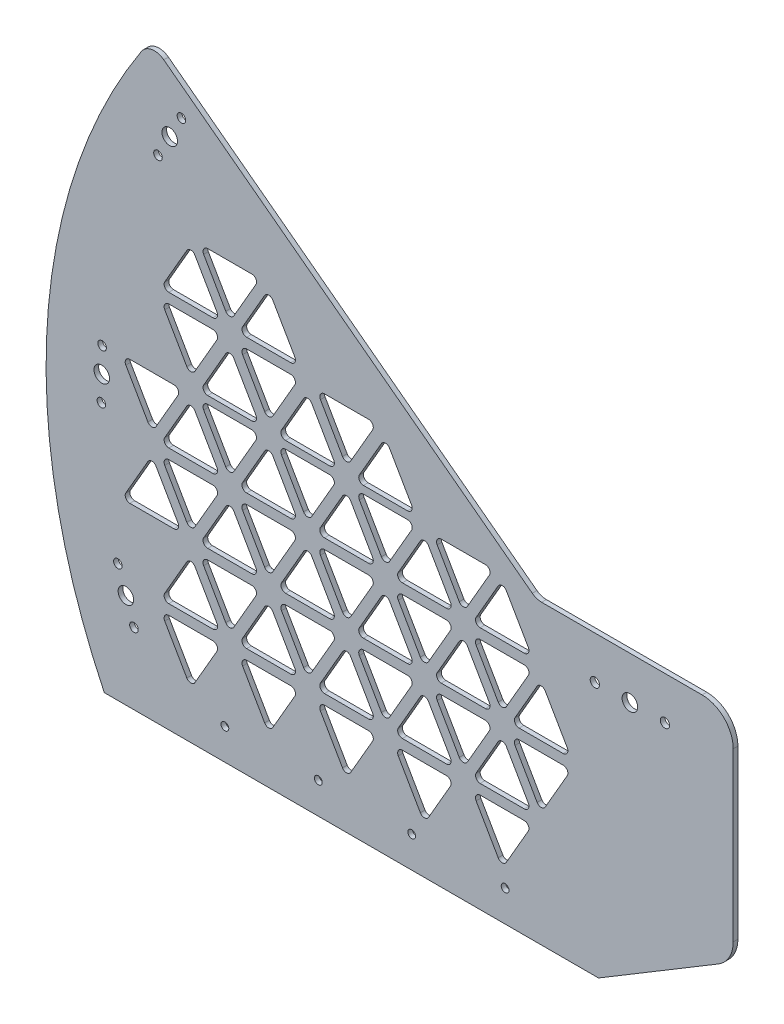
from build123d import *

# Parameters (mm, degrees)
BOSS_EXTRUDE1_OUTLINE_R   = 2.75
BOSS_EXTRUDE1_OUTLINE_R_2 = 5
BOSS_EXTRUDE1_OUTLINE_R_3 = 2.499999993
BOSS_EXTRUDE1_OUTLINE_R_4 = 3
BOSS_EXTRUDE1_DEPTH       = 3
CUT_EXTRUDE1_DEPTH        = 3


# Read off the part's stored shape, not the designer's step: Boss-Extrude1
with BuildPart() as part:
    # Boss-Extrude1 outline → Boss-Extrude1 (new body)
    with BuildSketch(Plane.XY):
        with BuildLine():
            ThreePointArc((56.677553307, -117.080446425), (63.779903671, -109.786095566), (66.371177049, -99.940475351))
            Line((66.371177049, -99.940475351), (66.371177049, 7.470187014))
            ThreePointArc((66.371177049, 7.470187014), (60.513312673, 21.612322638), (46.371177049, 27.470187014))
            Line((46.371177049, 27.470187014), (-56.688822951, 27.470187014))
            ThreePointArc((-56.688822951, 27.470187014), (-59.861869515, 27.986950462), (-62.706973182, 29.483831914))
            Line((-62.706973182, 29.483831914), (-299.401477059, 207.845933947))
            ThreePointArc((-299.401477059, 207.845933947), (-307.138934384, 209.7106693), (-313.787288313, 205.335183747))
            ThreePointArc((-313.787288313, 205.335183747), (-374.220792295, 24.161924642), (-337.587188831, -163.278565422))
            Line((-337.587188831, -163.278565422), (-20.152013506, -163.278565422))
            Line((-20.152013506, -163.278565422), (56.677553307, -117.080446425))
        make_face()
        with Locations((-318.548901543, -117.417406357)):
            Circle(BOSS_EXTRUDE1_OUTLINE_R, mode=Mode.SUBTRACT)
        with Locations((-323.727269541, -102.278565422)):
            Circle(BOSS_EXTRUDE1_OUTLINE_R_2, mode=Mode.SUBTRACT)
        with Locations((-328.90563754, -87.139724486)):
            Circle(BOSS_EXTRUDE1_OUTLINE_R, mode=Mode.SUBTRACT)
        with Locations((-260.152013506, -143.278565422)):
            Circle(BOSS_EXTRUDE1_OUTLINE_R_3, mode=Mode.SUBTRACT)
        with Locations((-200.152013506, -143.278565422)):
            Circle(BOSS_EXTRUDE1_OUTLINE_R_3, mode=Mode.SUBTRACT)
        with Locations((-339.48744704, -2.91946775)):
            Circle(BOSS_EXTRUDE1_OUTLINE_R, mode=Mode.SUBTRACT)
        with Locations((-339.247986793, 13.078740237)):
            Circle(BOSS_EXTRUDE1_OUTLINE_R_2, mode=Mode.SUBTRACT)
        with Locations((-140.152013506, -143.278565422)):
            Circle(BOSS_EXTRUDE1_OUTLINE_R_3, mode=Mode.SUBTRACT)
        with Locations((-80.152013506, -143.278565422)):
            Circle(BOSS_EXTRUDE1_OUTLINE_R_3, mode=Mode.SUBTRACT)
        with Locations((-22.5, 0)):
            Circle(BOSS_EXTRUDE1_OUTLINE_R_4, mode=Mode.SUBTRACT)
        with Locations((1.6e-08, 2e-09)):
            Circle(BOSS_EXTRUDE1_OUTLINE_R_2, mode=Mode.SUBTRACT)
        with Locations((22.5, 0)):
            Circle(BOSS_EXTRUDE1_OUTLINE_R_4, mode=Mode.SUBTRACT)
        with Locations((-339.008526547, 29.076948223)):
            Circle(BOSS_EXTRUDE1_OUTLINE_R, mode=Mode.SUBTRACT)
        with Locations((-303.123483222, 152.893439724)):
            Circle(BOSS_EXTRUDE1_OUTLINE_R, mode=Mode.SUBTRACT)
        with Locations((-295.583274349, 167.005323019)):
            Circle(BOSS_EXTRUDE1_OUTLINE_R_2, mode=Mode.SUBTRACT)
        with Locations((-288.043065475, 181.117206315)):
            Circle(BOSS_EXTRUDE1_OUTLINE_R, mode=Mode.SUBTRACT)
    extrude(amount=BOSS_EXTRUDE1_DEPTH)

    # Sketch2 → Cut-Extrude1 (cut)
    with BuildSketch(Plane.XY.offset(3)):
        with BuildLine():
            Line((-84.598076211, -42), (-98.772758664, -17.448729811))
            ThreePointArc((-98.772758664, -17.448729811), (-98.772758664, -14.448729811), (-96.174682453, -12.948729811))
            Line((-96.174682453, -12.948729811), (-67.825317547, -12.948729811))
            ThreePointArc((-67.825317547, -12.948729811), (-65.227241336, -14.448729811), (-65.227241336, -17.448729811))
            Line((-65.227241336, -17.448729811), (-79.401923789, -42))
            ThreePointArc((-79.401923789, -42), (-82, -43.5), (-84.598076211, -42))
        make_face()
        with BuildLine():
            Line((-134.598076211, -42), (-148.772758664, -17.448729811))
            ThreePointArc((-148.772758664, -17.448729811), (-148.772758664, -14.448729811), (-146.174682453, -12.948729811))
            Line((-146.174682453, -12.948729811), (-117.825317547, -12.948729811))
            ThreePointArc((-117.825317547, -12.948729811), (-115.227241336, -14.448729811), (-115.227241336, -17.448729811))
            Line((-115.227241336, -17.448729811), (-129.401923789, -42))
            ThreePointArc((-129.401923789, -42), (-132, -43.5), (-134.598076211, -42))
        make_face()
        with BuildLine():
            Line((-104.401923789, -20.698729811), (-90.227241336, -45.25))
            ThreePointArc((-90.227241336, -45.25), (-90.227241336, -48.25), (-92.825317547, -49.75))
            Line((-92.825317547, -49.75), (-121.174682453, -49.75))
            ThreePointArc((-121.174682453, -49.75), (-123.772758664, -48.25), (-123.772758664, -45.25))
            Line((-123.772758664, -45.25), (-109.598076211, -20.698729811))
            ThreePointArc((-109.598076211, -20.698729811), (-107, -19.198729811), (-104.401923789, -20.698729811))
        make_face()
        with BuildLine():
            Line((-90.227241336, -60.75), (-104.401923789, -85.301270189))
            ThreePointArc((-104.401923789, -85.301270189), (-107, -86.801270189), (-109.598076211, -85.301270189))
            Line((-109.598076211, -85.301270189), (-123.772758664, -60.75))
            ThreePointArc((-123.772758664, -60.75), (-123.772758664, -57.75), (-121.174682453, -56.25))
            Line((-121.174682453, -56.25), (-92.825317547, -56.25))
            ThreePointArc((-92.825317547, -56.25), (-90.227241336, -57.75), (-90.227241336, -60.75))
        make_face()
        with BuildLine():
            Line((-117.825317547, -93.051270189), (-146.174682453, -93.051270189))
            ThreePointArc((-146.174682453, -93.051270189), (-148.772758664, -91.551270189), (-148.772758664, -88.551270189))
            Line((-148.772758664, -88.551270189), (-134.598076211, -64))
            ThreePointArc((-134.598076211, -64), (-132, -62.5), (-129.401923789, -64))
            Line((-129.401923789, -64), (-115.227241336, -88.551270189))
            ThreePointArc((-115.227241336, -88.551270189), (-115.227241336, -91.551270189), (-117.825317547, -93.051270189))
        make_face()
        with BuildLine():
            Line((-159.598076211, -85.301270189), (-173.772758664, -60.75))
            ThreePointArc((-173.772758664, -60.75), (-173.772758664, -57.75), (-171.174682453, -56.25))
            Line((-171.174682453, -56.25), (-142.825317547, -56.25))
            ThreePointArc((-142.825317547, -56.25), (-140.227241336, -57.75), (-140.227241336, -60.75))
            Line((-140.227241336, -60.75), (-154.401923789, -85.301270189))
            ThreePointArc((-154.401923789, -85.301270189), (-157, -86.801270189), (-159.598076211, -85.301270189))
        make_face()
        with BuildLine():
            Line((-173.772758664, -45.25), (-159.598076211, -20.698729811))
            ThreePointArc((-159.598076211, -20.698729811), (-157, -19.198729811), (-154.401923789, -20.698729811))
            Line((-154.401923789, -20.698729811), (-140.227241336, -45.25))
            ThreePointArc((-140.227241336, -45.25), (-140.227241336, -48.25), (-142.825317547, -49.75))
            Line((-142.825317547, -49.75), (-171.174682453, -49.75))
            ThreePointArc((-171.174682453, -49.75), (-173.772758664, -48.25), (-173.772758664, -45.25))
        make_face()
        with BuildLine():
            Line((-54.401923789, -20.698729811), (-40.227241336, -45.25))
            ThreePointArc((-40.227241336, -45.25), (-40.227241336, -48.25), (-42.825317547, -49.75))
            Line((-42.825317547, -49.75), (-71.174682453, -49.75))
            ThreePointArc((-71.174682453, -49.75), (-73.772758664, -48.25), (-73.772758664, -45.25))
            Line((-73.772758664, -45.25), (-59.598076211, -20.698729811))
            ThreePointArc((-59.598076211, -20.698729811), (-57, -19.198729811), (-54.401923789, -20.698729811))
        make_face()
        with BuildLine():
            Line((-40.227241336, -60.75), (-54.401923789, -85.301270189))
            ThreePointArc((-54.401923789, -85.301270189), (-57, -86.801270189), (-59.598076211, -85.301270189))
            Line((-59.598076211, -85.301270189), (-73.772758664, -60.75))
            ThreePointArc((-73.772758664, -60.75), (-73.772758664, -57.75), (-71.174682453, -56.25))
            Line((-71.174682453, -56.25), (-42.825317547, -56.25))
            ThreePointArc((-42.825317547, -56.25), (-40.227241336, -57.75), (-40.227241336, -60.75))
        make_face()
        with BuildLine():
            Line((-67.825317547, -93.051270189), (-96.174682453, -93.051270189))
            ThreePointArc((-96.174682453, -93.051270189), (-98.772758664, -91.551270189), (-98.772758664, -88.551270189))
            Line((-98.772758664, -88.551270189), (-84.598076211, -64))
            ThreePointArc((-84.598076211, -64), (-82, -62.5), (-79.401923789, -64))
            Line((-79.401923789, -64), (-65.227241336, -88.551270189))
            ThreePointArc((-65.227241336, -88.551270189), (-65.227241336, -91.551270189), (-67.825317547, -93.051270189))
        make_face()
        with BuildLine():
            Line((-259.598076211, -85.301270189), (-273.772758664, -60.75))
            ThreePointArc((-273.772758664, -60.75), (-273.772758664, -57.75), (-271.174682453, -56.25))
            Line((-271.174682453, -56.25), (-242.825317547, -56.25))
            ThreePointArc((-242.825317547, -56.25), (-240.227241336, -57.75), (-240.227241336, -60.75))
            Line((-240.227241336, -60.75), (-254.401923789, -85.301270189))
            ThreePointArc((-254.401923789, -85.301270189), (-257, -86.801270189), (-259.598076211, -85.301270189))
        make_face()
        with BuildLine():
            Line((-184.598076211, -42), (-198.772758664, -17.448729811))
            ThreePointArc((-198.772758664, -17.448729811), (-198.772758664, -14.448729811), (-196.174682453, -12.948729811))
            Line((-196.174682453, -12.948729811), (-167.825317547, -12.948729811))
            ThreePointArc((-167.825317547, -12.948729811), (-165.227241336, -14.448729811), (-165.227241336, -17.448729811))
            Line((-165.227241336, -17.448729811), (-179.401923789, -42))
            ThreePointArc((-179.401923789, -42), (-182, -43.5), (-184.598076211, -42))
        make_face()
        with BuildLine():
            Line((-167.825317547, -93.051270189), (-196.174682453, -93.051270189))
            ThreePointArc((-196.174682453, -93.051270189), (-198.772758664, -91.551270189), (-198.772758664, -88.551270189))
            Line((-198.772758664, -88.551270189), (-184.598076211, -64))
            ThreePointArc((-184.598076211, -64), (-182, -62.5), (-179.401923789, -64))
            Line((-179.401923789, -64), (-165.227241336, -88.551270189))
            ThreePointArc((-165.227241336, -88.551270189), (-165.227241336, -91.551270189), (-167.825317547, -93.051270189))
        make_face()
        with BuildLine():
            Line((-209.598076211, -85.301270189), (-223.772758664, -60.75))
            ThreePointArc((-223.772758664, -60.75), (-223.772758664, -57.75), (-221.174682453, -56.25))
            Line((-221.174682453, -56.25), (-192.825317547, -56.25))
            ThreePointArc((-192.825317547, -56.25), (-190.227241336, -57.75), (-190.227241336, -60.75))
            Line((-190.227241336, -60.75), (-204.401923789, -85.301270189))
            ThreePointArc((-204.401923789, -85.301270189), (-207, -86.801270189), (-209.598076211, -85.301270189))
        make_face()
        with BuildLine():
            Line((-223.772758664, -45.25), (-209.598076211, -20.698729811))
            ThreePointArc((-209.598076211, -20.698729811), (-207, -19.198729811), (-204.401923789, -20.698729811))
            Line((-204.401923789, -20.698729811), (-190.227241336, -45.25))
            ThreePointArc((-190.227241336, -45.25), (-190.227241336, -48.25), (-192.825317547, -49.75))
            Line((-192.825317547, -49.75), (-221.174682453, -49.75))
            ThreePointArc((-221.174682453, -49.75), (-223.772758664, -48.25), (-223.772758664, -45.25))
        make_face()
        with BuildLine():
            Line((-234.598076211, -42), (-248.772758664, -17.448729811))
            ThreePointArc((-248.772758664, -17.448729811), (-248.772758664, -14.448729811), (-246.174682453, -12.948729811))
            Line((-246.174682453, -12.948729811), (-217.825317547, -12.948729811))
            ThreePointArc((-217.825317547, -12.948729811), (-215.227241336, -14.448729811), (-215.227241336, -17.448729811))
            Line((-215.227241336, -17.448729811), (-229.401923789, -42))
            ThreePointArc((-229.401923789, -42), (-232, -43.5), (-234.598076211, -42))
        make_face()
        with BuildLine():
            Line((-217.825317547, -93.051270189), (-246.174682453, -93.051270189))
            ThreePointArc((-246.174682453, -93.051270189), (-248.772758664, -91.551270189), (-248.772758664, -88.551270189))
            Line((-248.772758664, -88.551270189), (-234.598076211, -64))
            ThreePointArc((-234.598076211, -64), (-232, -62.5), (-229.401923789, -64))
            Line((-229.401923789, -64), (-215.227241336, -88.551270189))
            ThreePointArc((-215.227241336, -88.551270189), (-215.227241336, -91.551270189), (-217.825317547, -93.051270189))
        make_face()
        with BuildLine():
            Line((-234.598076211, 44.602540378), (-248.772758664, 69.153810568))
            ThreePointArc((-248.772758664, 69.153810568), (-248.772758664, 72.153810568), (-246.174682453, 73.653810568))
            Line((-246.174682453, 73.653810568), (-217.825317547, 73.653810568))
            ThreePointArc((-217.825317547, 73.653810568), (-215.227241336, 72.153810568), (-215.227241336, 69.153810568))
            Line((-215.227241336, 69.153810568), (-229.401923789, 44.602540378))
            ThreePointArc((-229.401923789, 44.602540378), (-232, 43.102540378), (-234.598076211, 44.602540378))
        make_face()
        with BuildLine():
            Line((-217.825317547, -6.448729811), (-246.174682453, -6.448729811))
            ThreePointArc((-246.174682453, -6.448729811), (-248.772758664, -4.948729811), (-248.772758664, -1.948729811))
            Line((-248.772758664, -1.948729811), (-234.598076211, 22.602540378))
            ThreePointArc((-234.598076211, 22.602540378), (-232, 24.102540378), (-229.401923789, 22.602540378))
            Line((-229.401923789, 22.602540378), (-215.227241336, -1.948729811))
            ThreePointArc((-215.227241336, -1.948729811), (-215.227241336, -4.948729811), (-217.825317547, -6.448729811))
        make_face()
        with BuildLine():
            Line((-217.825317547, 80.153810568), (-246.174682453, 80.153810568))
            ThreePointArc((-246.174682453, 80.153810568), (-248.772758664, 81.653810568), (-248.772758664, 84.653810568))
            Line((-248.772758664, 84.653810568), (-234.598076211, 109.205080757))
            ThreePointArc((-234.598076211, 109.205080757), (-232, 110.705080757), (-229.401923789, 109.205080757))
            Line((-229.401923789, 109.205080757), (-215.227241336, 84.653810568))
            ThreePointArc((-215.227241336, 84.653810568), (-215.227241336, 81.653810568), (-217.825317547, 80.153810568))
        make_face()
        with BuildLine():
            Line((-184.598076211, 44.602540378), (-198.772758664, 69.153810568))
            ThreePointArc((-198.772758664, 69.153810568), (-198.772758664, 72.153810568), (-196.174682453, 73.653810568))
            Line((-196.174682453, 73.653810568), (-167.825317547, 73.653810568))
            ThreePointArc((-167.825317547, 73.653810568), (-165.227241336, 72.153810568), (-165.227241336, 69.153810568))
            Line((-165.227241336, 69.153810568), (-179.401923789, 44.602540378))
            ThreePointArc((-179.401923789, 44.602540378), (-182, 43.102540378), (-184.598076211, 44.602540378))
        make_face()
        with BuildLine():
            Line((-167.825317547, -6.448729811), (-196.174682453, -6.448729811))
            ThreePointArc((-196.174682453, -6.448729811), (-198.772758664, -4.948729811), (-198.772758664, -1.948729811))
            Line((-198.772758664, -1.948729811), (-184.598076211, 22.602540378))
            ThreePointArc((-184.598076211, 22.602540378), (-182, 24.102540378), (-179.401923789, 22.602540378))
            Line((-179.401923789, 22.602540378), (-165.227241336, -1.948729811))
            ThreePointArc((-165.227241336, -1.948729811), (-165.227241336, -4.948729811), (-167.825317547, -6.448729811))
        make_face()
        with BuildLine():
            Line((-117.825317547, -6.448729811), (-146.174682453, -6.448729811))
            ThreePointArc((-146.174682453, -6.448729811), (-148.772758664, -4.948729811), (-148.772758664, -1.948729811))
            Line((-148.772758664, -1.948729811), (-134.598076211, 22.602540378))
            ThreePointArc((-134.598076211, 22.602540378), (-132, 24.102540378), (-129.401923789, 22.602540378))
            Line((-129.401923789, 22.602540378), (-115.227241336, -1.948729811))
            ThreePointArc((-115.227241336, -1.948729811), (-115.227241336, -4.948729811), (-117.825317547, -6.448729811))
        make_face()
        with BuildLine():
            Line((-67.825317547, -6.448729811), (-96.174682453, -6.448729811))
            ThreePointArc((-96.174682453, -6.448729811), (-98.772758664, -4.948729811), (-98.772758664, -1.948729811))
            Line((-98.772758664, -1.948729811), (-84.598076211, 22.602540378))
            ThreePointArc((-84.598076211, 22.602540378), (-82, 24.102540378), (-79.401923789, 22.602540378))
            Line((-79.401923789, 22.602540378), (-65.227241336, -1.948729811))
            ThreePointArc((-65.227241336, -1.948729811), (-65.227241336, -4.948729811), (-67.825317547, -6.448729811))
        make_face()
        with BuildLine():
            Line((-84.598076211, -128.602540378), (-98.772758664, -104.051270189))
            ThreePointArc((-98.772758664, -104.051270189), (-98.772758664, -101.051270189), (-96.174682453, -99.551270189))
            Line((-96.174682453, -99.551270189), (-67.825317547, -99.551270189))
            ThreePointArc((-67.825317547, -99.551270189), (-65.227241336, -101.051270189), (-65.227241336, -104.051270189))
            Line((-65.227241336, -104.051270189), (-79.401923789, -128.602540378))
            ThreePointArc((-79.401923789, -128.602540378), (-82, -130.102540378), (-84.598076211, -128.602540378))
        make_face()
        with BuildLine():
            Line((-134.598076211, -128.602540378), (-148.772758664, -104.051270189))
            ThreePointArc((-148.772758664, -104.051270189), (-148.772758664, -101.051270189), (-146.174682453, -99.551270189))
            Line((-146.174682453, -99.551270189), (-117.825317547, -99.551270189))
            ThreePointArc((-117.825317547, -99.551270189), (-115.227241336, -101.051270189), (-115.227241336, -104.051270189))
            Line((-115.227241336, -104.051270189), (-129.401923789, -128.602540378))
            ThreePointArc((-129.401923789, -128.602540378), (-132, -130.102540378), (-134.598076211, -128.602540378))
        make_face()
        with BuildLine():
            Line((-184.598076211, -128.602540378), (-198.772758664, -104.051270189))
            ThreePointArc((-198.772758664, -104.051270189), (-198.772758664, -101.051270189), (-196.174682453, -99.551270189))
            Line((-196.174682453, -99.551270189), (-167.825317547, -99.551270189))
            ThreePointArc((-167.825317547, -99.551270189), (-165.227241336, -101.051270189), (-165.227241336, -104.051270189))
            Line((-165.227241336, -104.051270189), (-179.401923789, -128.602540378))
            ThreePointArc((-179.401923789, -128.602540378), (-182, -130.102540378), (-184.598076211, -128.602540378))
        make_face()
        with BuildLine():
            Line((-234.598076211, -128.602540378), (-248.772758664, -104.051270189))
            ThreePointArc((-248.772758664, -104.051270189), (-248.772758664, -101.051270189), (-246.174682453, -99.551270189))
            Line((-246.174682453, -99.551270189), (-217.825317547, -99.551270189))
            ThreePointArc((-217.825317547, -99.551270189), (-215.227241336, -101.051270189), (-215.227241336, -104.051270189))
            Line((-215.227241336, -104.051270189), (-229.401923789, -128.602540378))
            ThreePointArc((-229.401923789, -128.602540378), (-232, -130.102540378), (-234.598076211, -128.602540378))
        make_face()
        with BuildLine():
            Line((-209.598076211, 1.301270189), (-223.772758664, 25.852540378))
            ThreePointArc((-223.772758664, 25.852540378), (-223.772758664, 28.852540378), (-221.174682453, 30.352540378))
            Line((-221.174682453, 30.352540378), (-192.825317547, 30.352540378))
            ThreePointArc((-192.825317547, 30.352540378), (-190.227241336, 28.852540378), (-190.227241336, 25.852540378))
            Line((-190.227241336, 25.852540378), (-204.401923789, 1.301270189))
            ThreePointArc((-204.401923789, 1.301270189), (-207, -0.198729811), (-209.598076211, 1.301270189))
        make_face()
        with BuildLine():
            Line((-159.598076211, 1.301270189), (-173.772758664, 25.852540378))
            ThreePointArc((-173.772758664, 25.852540378), (-173.772758664, 28.852540378), (-171.174682453, 30.352540378))
            Line((-171.174682453, 30.352540378), (-142.825317547, 30.352540378))
            ThreePointArc((-142.825317547, 30.352540378), (-140.227241336, 28.852540378), (-140.227241336, 25.852540378))
            Line((-140.227241336, 25.852540378), (-154.401923789, 1.301270189))
            ThreePointArc((-154.401923789, 1.301270189), (-157, -0.198729811), (-159.598076211, 1.301270189))
        make_face()
        with BuildLine():
            Line((-223.772758664, 39.75), (-209.598076211, 64.301270189))
            ThreePointArc((-209.598076211, 64.301270189), (-207, 65.801270189), (-204.401923789, 64.301270189))
            Line((-204.401923789, 64.301270189), (-190.227241336, 39.75))
            ThreePointArc((-190.227241336, 39.75), (-190.227241336, 36.75), (-192.825317547, 35.25))
            Line((-192.825317547, 35.25), (-221.174682453, 35.25))
            ThreePointArc((-221.174682453, 35.25), (-223.772758664, 36.75), (-223.772758664, 39.75))
        make_face()
        with BuildLine():
            Line((-142.825317547, 35.25), (-171.174682453, 35.25))
            ThreePointArc((-171.174682453, 35.25), (-173.772758664, 36.75), (-173.772758664, 39.75))
            Line((-173.772758664, 39.75), (-159.598076211, 64.301270189))
            ThreePointArc((-159.598076211, 64.301270189), (-157, 65.801270189), (-154.401923789, 64.301270189))
            Line((-154.401923789, 64.301270189), (-140.227241336, 39.75))
            ThreePointArc((-140.227241336, 39.75), (-140.227241336, 36.75), (-142.825317547, 35.25))
        make_face()
        with BuildLine():
            Line((-109.598076211, 1.301270189), (-123.772758664, 25.852540378))
            ThreePointArc((-123.772758664, 25.852540378), (-123.772758664, 28.852540378), (-121.174682453, 30.352540378))
            Line((-121.174682453, 30.352540378), (-92.825317547, 30.352540378))
            ThreePointArc((-92.825317547, 30.352540378), (-90.227241336, 28.852540378), (-90.227241336, 25.852540378))
            Line((-90.227241336, 25.852540378), (-104.401923789, 1.301270189))
            ThreePointArc((-104.401923789, 1.301270189), (-107, -0.198729811), (-109.598076211, 1.301270189))
        make_face()
        with BuildLine():
            Line((-273.772758664, -45.25), (-259.598076211, -20.698729811))
            ThreePointArc((-259.598076211, -20.698729811), (-257, -19.198729811), (-254.401923789, -20.698729811))
            Line((-254.401923789, -20.698729811), (-240.227241336, -45.25))
            ThreePointArc((-240.227241336, -45.25), (-240.227241336, -48.25), (-242.825317547, -49.75))
            Line((-242.825317547, -49.75), (-271.174682453, -49.75))
            ThreePointArc((-271.174682453, -49.75), (-273.772758664, -48.25), (-273.772758664, -45.25))
        make_face()
        with BuildLine():
            Line((-284.598076211, -42), (-298.772758664, -17.448729811))
            ThreePointArc((-298.772758664, -17.448729811), (-298.772758664, -14.448729811), (-296.174682453, -12.948729811))
            Line((-296.174682453, -12.948729811), (-267.825317547, -12.948729811))
            ThreePointArc((-267.825317547, -12.948729811), (-265.227241336, -14.448729811), (-265.227241336, -17.448729811))
            Line((-265.227241336, -17.448729811), (-279.401923789, -42))
            ThreePointArc((-279.401923789, -42), (-282, -43.5), (-284.598076211, -42))
        make_face()
        with BuildLine():
            Line((-267.825317547, -6.448729811), (-296.174682453, -6.448729811))
            ThreePointArc((-296.174682453, -6.448729811), (-298.772758664, -4.948729811), (-298.772758664, -1.948729811))
            Line((-298.772758664, -1.948729811), (-284.598076211, 22.602540378))
            ThreePointArc((-284.598076211, 22.602540378), (-282, 24.102540378), (-279.401923789, 22.602540378))
            Line((-279.401923789, 22.602540378), (-265.227241336, -1.948729811))
            ThreePointArc((-265.227241336, -1.948729811), (-265.227241336, -4.948729811), (-267.825317547, -6.448729811))
        make_face()
        with BuildLine():
            Line((-259.598076211, 1.301270189), (-273.772758664, 25.852540378))
            ThreePointArc((-273.772758664, 25.852540378), (-273.772758664, 28.852540378), (-271.174682453, 30.352540378))
            Line((-271.174682453, 30.352540378), (-242.825317547, 30.352540378))
            ThreePointArc((-242.825317547, 30.352540378), (-240.227241336, 28.852540378), (-240.227241336, 25.852540378))
            Line((-240.227241336, 25.852540378), (-254.401923789, 1.301270189))
            ThreePointArc((-254.401923789, 1.301270189), (-257, -0.198729811), (-259.598076211, 1.301270189))
        make_face()
        with BuildLine():
            Line((-273.772758664, 39.75), (-259.598076211, 64.301270189))
            ThreePointArc((-259.598076211, 64.301270189), (-257, 65.801270189), (-254.401923789, 64.301270189))
            Line((-254.401923789, 64.301270189), (-240.227241336, 39.75))
            ThreePointArc((-240.227241336, 39.75), (-240.227241336, 36.75), (-242.825317547, 35.25))
            Line((-242.825317547, 35.25), (-271.174682453, 35.25))
            ThreePointArc((-271.174682453, 35.25), (-273.772758664, 36.75), (-273.772758664, 39.75))
        make_face()
        with BuildLine():
            Line((-267.825317547, -93.051270189), (-296.174682453, -93.051270189))
            ThreePointArc((-296.174682453, -93.051270189), (-298.772758664, -91.551270189), (-298.772758664, -88.551270189))
            Line((-298.772758664, -88.551270189), (-284.598076211, -64))
            ThreePointArc((-284.598076211, -64), (-282, -62.5), (-279.401923789, -64))
            Line((-279.401923789, -64), (-265.227241336, -88.551270189))
            ThreePointArc((-265.227241336, -88.551270189), (-265.227241336, -91.551270189), (-267.825317547, -93.051270189))
        make_face()
        with BuildLine():
            Line((-284.598076211, -128.602540378), (-298.772758664, -104.051270189))
            ThreePointArc((-298.772758664, -104.051270189), (-298.772758664, -101.051270189), (-296.174682453, -99.551270189))
            Line((-296.174682453, -99.551270189), (-267.825317547, -99.551270189))
            ThreePointArc((-267.825317547, -99.551270189), (-265.227241336, -101.051270189), (-265.227241336, -104.051270189))
            Line((-265.227241336, -104.051270189), (-279.401923789, -128.602540378))
            ThreePointArc((-279.401923789, -128.602540378), (-282, -130.102540378), (-284.598076211, -128.602540378))
        make_face()
        with BuildLine():
            Line((-284.598076211, 44.602540378), (-298.772758664, 69.153810568))
            ThreePointArc((-298.772758664, 69.153810568), (-298.772758664, 72.153810568), (-296.174682453, 73.653810568))
            Line((-296.174682453, 73.653810568), (-267.825317547, 73.653810568))
            ThreePointArc((-267.825317547, 73.653810568), (-265.227241336, 72.153810568), (-265.227241336, 69.153810568))
            Line((-265.227241336, 69.153810568), (-279.401923789, 44.602540378))
            ThreePointArc((-279.401923789, 44.602540378), (-282, 43.102540378), (-284.598076211, 44.602540378))
        make_face()
        with BuildLine():
            Line((-259.598076211, 87.903810568), (-273.772758664, 112.455080757))
            ThreePointArc((-273.772758664, 112.455080757), (-273.772758664, 115.455080757), (-271.174682453, 116.955080757))
            Line((-271.174682453, 116.955080757), (-242.825317547, 116.955080757))
            ThreePointArc((-242.825317547, 116.955080757), (-240.227241336, 115.455080757), (-240.227241336, 112.455080757))
            Line((-240.227241336, 112.455080757), (-254.401923789, 87.903810568))
            ThreePointArc((-254.401923789, 87.903810568), (-257, 86.403810568), (-259.598076211, 87.903810568))
        make_face()
        with BuildLine():
            Line((-292.825317547, -49.75), (-321.174682453, -49.75))
            ThreePointArc((-321.174682453, -49.75), (-323.772758664, -48.25), (-323.772758664, -45.25))
            Line((-323.772758664, -45.25), (-309.598076211, -20.698729811))
            ThreePointArc((-309.598076211, -20.698729811), (-307, -19.198729811), (-304.401923789, -20.698729811))
            Line((-304.401923789, -20.698729811), (-290.227241336, -45.25))
            ThreePointArc((-290.227241336, -45.25), (-290.227241336, -48.25), (-292.825317547, -49.75))
        make_face()
        with BuildLine():
            Line((-309.598076211, 1.301270189), (-323.772758664, 25.852540378))
            ThreePointArc((-323.772758664, 25.852540378), (-323.772758664, 28.852540378), (-321.174682453, 30.352540378))
            Line((-321.174682453, 30.352540378), (-292.825317547, 30.352540378))
            ThreePointArc((-292.825317547, 30.352540378), (-290.227241336, 28.852540378), (-290.227241336, 25.852540378))
            Line((-290.227241336, 25.852540378), (-304.401923789, 1.301270189))
            ThreePointArc((-304.401923789, 1.301270189), (-307, -0.198729811), (-309.598076211, 1.301270189))
        make_face()
        with BuildLine():
            Line((-267.825317547, 80.153810568), (-296.174682453, 80.153810568))
            ThreePointArc((-296.174682453, 80.153810568), (-298.772758664, 81.653810568), (-298.772758664, 84.653810568))
            Line((-298.772758664, 84.653810568), (-284.598076211, 109.205080757))
            ThreePointArc((-284.598076211, 109.205080757), (-282, 110.705080757), (-279.401923789, 109.205080757))
            Line((-279.401923789, 109.205080757), (-265.227241336, 84.653810568))
            ThreePointArc((-265.227241336, 84.653810568), (-265.227241336, 81.653810568), (-267.825317547, 80.153810568))
        make_face()
    extrude(amount=-CUT_EXTRUDE1_DEPTH, mode=Mode.SUBTRACT)


solid = part.part
